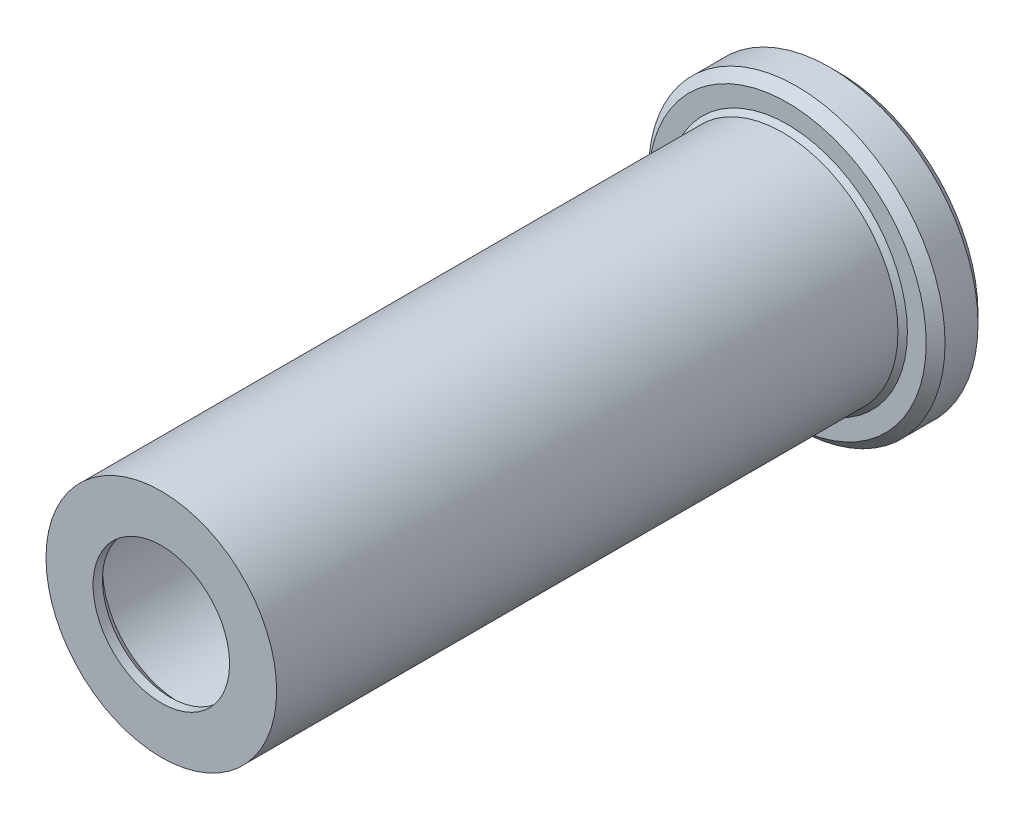
from build123d import *

# Parameters (mm, degrees)
SKETCH1_R           = 12.25
SKETCH1_R_2         = 9.25
EXTRUDE_THIN1_DEPTH = 70
SKETCH3_R           = 15.75
SKETCH3_R_2         = 10.75
EXTRUDE_THIN2_DEPTH = 5.5
SKETCH4_R           = 12.25
SKETCH4_R_2         = 7.25
EXTRUDE_THIN3_DEPTH = 2


with BuildPart() as part:
    # Sketch1 → Extrude-Thin1 (new body)
    with BuildSketch(Plane(origin=(0, 0, 0), x_dir=(0, 1, 0), z_dir=(0, 0, 1))):
        Circle(SKETCH1_R)
        Circle(SKETCH1_R_2, mode=Mode.SUBTRACT)
    extrude(amount=EXTRUDE_THIN1_DEPTH)

    # Sketch3 → Extrude-Thin2 (add)
    with BuildSketch(Plane(origin=(0, 0, 0), x_dir=(0, 1, 0), z_dir=(0, 0, 1))):
        Circle(SKETCH3_R)
        Circle(SKETCH3_R_2, mode=Mode.SUBTRACT)
    extrude(amount=EXTRUDE_THIN2_DEPTH)

    # Sketch4 → Extrude-Thin3 (add)
    with BuildSketch(Plane.XY.offset(70)):
        Circle(SKETCH4_R)
        Circle(SKETCH4_R_2, mode=Mode.SUBTRACT)
    extrude(amount=EXTRUDE_THIN3_DEPTH)

    # Chamfer1: read off the stored shape, not the designer's step
    # Chamfer1 outline → Chamfer1 (revolve, cut)
    with BuildSketch(Plane.XZ):
        Polygon((9.25, 2), (9.25, 0), (11.25, 0), align=None)
        Polygon((15.75, 1), (14.75, 0), (15.75, 0), align=None)
        Polygon((7.25, 70), (8.25, 70), (7.25, 71), align=None)
        Polygon((14.75, 5.5), (15.75, 4.5), (15.75, 5.5), align=None)
    revolve(axis=Axis((0, 0, 0), (0, 0, 1)), mode=Mode.SUBTRACT)

    # Chamfer1 2 outline → Chamfer1 2 (revolve)
    with BuildSketch(Plane.XZ):
        Polygon((12.25, 6), (12.25, 5.5), (12.75, 5.5), align=None)
    revolve(axis=Axis((0, 0, 0), (0, 0, 1)))


solid = part.part
